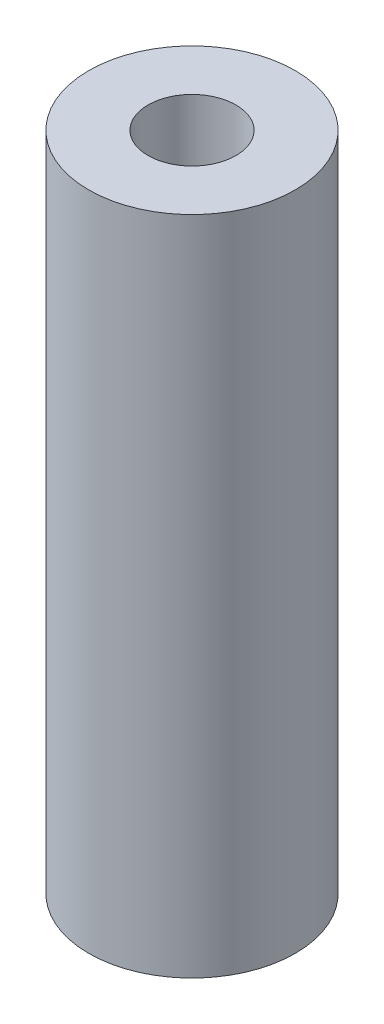
from build123d import *

# Parameters (mm, degrees)
SKETCH1_R           = 7.9375
SKETCH1_R_2         = 3.3734375
BOSS_EXTRUDE1_DEPTH = 50.8


with BuildPart() as part:
    # Sketch1 → Boss-Extrude1 (new body)
    with BuildSketch(Plane(origin=(0, 0, 0), x_dir=(1, 0, 0), z_dir=(0, 1, 0))):
        Circle(SKETCH1_R)
        Circle(SKETCH1_R_2, mode=Mode.SUBTRACT)
    extrude(amount=BOSS_EXTRUDE1_DEPTH)


solid = part.part
